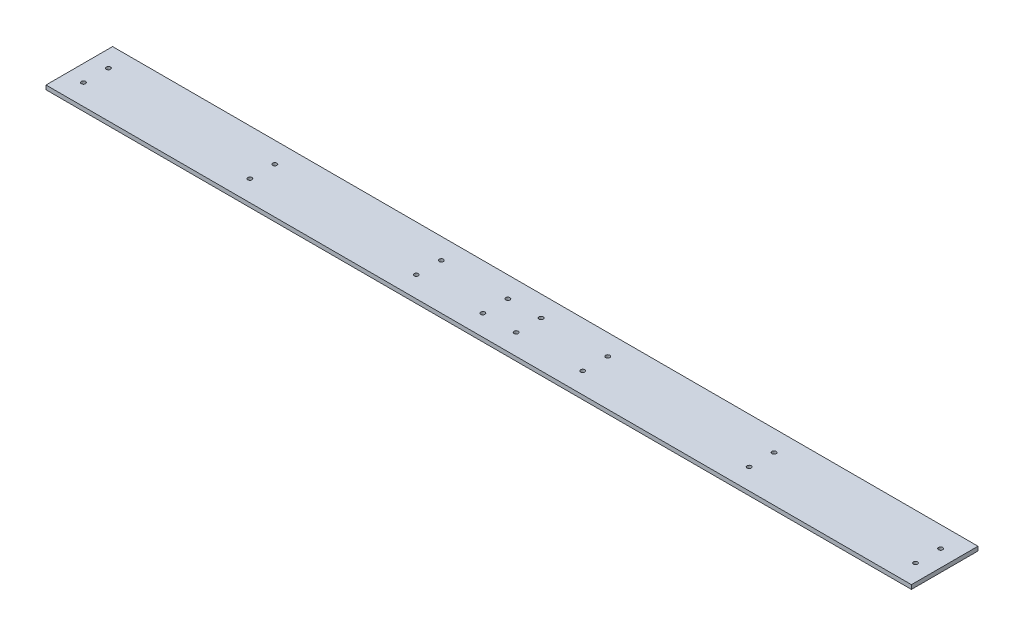
from build123d import *

# Parameters (mm, degrees)
SKETCH1_W           = 1040
SKETCH1_H           = 80
SKETCH1_R           = 2.5
BOSS_EXTRUDE1_DEPTH = 5


with BuildPart() as part:
    # Sketch1 → Boss-Extrude1 (new body)
    with BuildSketch(Plane(origin=(0, 0, 0), x_dir=(1, 0, 0), z_dir=(0, 1, 0))):
        with Locations((500, 0)):
            Rectangle(SKETCH1_W, SKETCH1_H)
        with Locations((0, 15)):
            Circle(SKETCH1_R, mode=Mode.SUBTRACT)
        with Locations((0, -15)):
            Circle(SKETCH1_R, mode=Mode.SUBTRACT)
        with Locations((200, -15)):
            Circle(SKETCH1_R, mode=Mode.SUBTRACT)
        with Locations((200, 15)):
            Circle(SKETCH1_R, mode=Mode.SUBTRACT)
        with Locations((400, -15)):
            Circle(SKETCH1_R, mode=Mode.SUBTRACT)
        with Locations((400, 15)):
            Circle(SKETCH1_R, mode=Mode.SUBTRACT)
        with Locations((600, -15)):
            Circle(SKETCH1_R, mode=Mode.SUBTRACT)
        with Locations((600, 15)):
            Circle(SKETCH1_R, mode=Mode.SUBTRACT)
        with Locations((800, -15)):
            Circle(SKETCH1_R, mode=Mode.SUBTRACT)
        with Locations((800, 15)):
            Circle(SKETCH1_R, mode=Mode.SUBTRACT)
        with Locations((1000, -15)):
            Circle(SKETCH1_R, mode=Mode.SUBTRACT)
        with Locations((1000, 15)):
            Circle(SKETCH1_R, mode=Mode.SUBTRACT)
        with Locations((480, 15)):
            Circle(SKETCH1_R, mode=Mode.SUBTRACT)
        with Locations((520, 15)):
            Circle(SKETCH1_R, mode=Mode.SUBTRACT)
        with Locations((520, -15)):
            Circle(SKETCH1_R, mode=Mode.SUBTRACT)
        with Locations((480, -15)):
            Circle(SKETCH1_R, mode=Mode.SUBTRACT)
    extrude(amount=BOSS_EXTRUDE1_DEPTH)


solid = part.part
